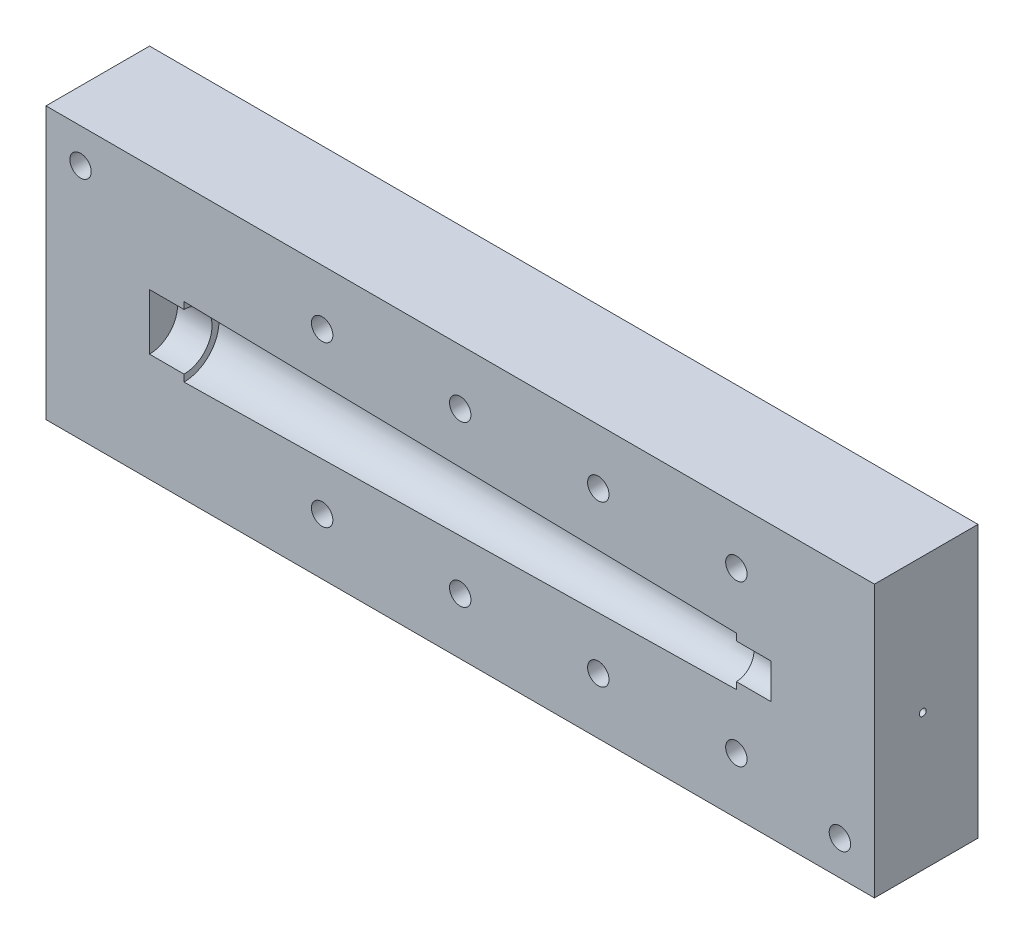
from build123d import *

# Parameters (mm, degrees)
SKIZZE2_W                        = 120
SKIZZE2_H                        = 39.364160046
AUFSATZ_LINEAR_AUSTRAGEN1_DEPTH  = 30
SKIZZE24_R                       = 1.55
SCHNITT_LINEAR_AUSTRAGEN4_DEPTH  = 130.805766806
SKIZZE46_R                       = 2.85
SCHNITT_LINEAR_AUSTRAGEN15_DEPTH = 10
SCHNITT_LINEAR_START             = -5
SCHNITT_LINEAR_AUSTRAGEN25_DEPTH = 2.7
LINEARES_MUSTER1_COUNT           = 4
LINEARES_MUSTER1_PITCH           = 20
SPIEGELN2_COPY_1_SKETCH_R        = 2.85
SPIEGELN2_COPY_1_DEPTH           = 10
SPIEGELN2_COPY_2_SKETCH_R        = 2.85
SPIEGELN2_COPY_2_DEPTH           = 10
SPIEGELN2_COPY_3_SKETCH_R        = 2.85
SPIEGELN2_COPY_3_DEPTH           = 10
SPIEGELN2_START                  = -5
SPIEGELN2_COPY_4_DEPTH           = 2.7
SPIEGELN2_COPY_5_DEPTH           = 2.7
SPIEGELN2_COPY_6_DEPTH           = 2.7
SKIZZE51_R                       = 1.55
SCHNITT_LINEAR_AUSTRAGEN26_DEPTH = 130.805766806
SKIZZE75_R                       = 0.75
SCHNITT_LINEAR_AUSTRAGEN28_DEPTH = 12
SKIZZE76_R                       = 2
SCHNITT_LINEAR_AUSTRAGEN29_DEPTH = 6
SKIZZE80_R                       = 0.5
SCHNITT_LINEAR_AUSTRAGEN34_DEPTH = 21.05
SCHNITT_LINEAR_START_2           = -7.5
SKIZZE81_R                       = 0.5
SCHNITT_LINEAR_AUSTRAGEN36_DEPTH = 5
FASE1_SIZE                       = 1
ABSPALTEN3_START                 = 15
ABSPALTEN3_OUTLINE_W             = 120
ABSPALTEN3_OUTLINE_H             = 39.364160046
ABSPALTEN3_OUTLINE_R             = 1.55
ABSPALTEN3_OUTLINE_R_2           = 0.75
ABSPALTEN3_DEPTH                 = 15


# Read off the part's stored shape, not the designer's step: Abspalten3
with BuildPart() as part:
    # Skizze2 → Aufsatz-Linear austragen1 (new body)
    with BuildSketch(Plane.XY):
        with Locations((60, 19.682080023)):
            Rectangle(SKIZZE2_W, SKIZZE2_H)
    extrude(amount=AUFSATZ_LINEAR_AUSTRAGEN1_DEPTH)

    # Skizze24 → Schnitt-Linear austragen4 (cut, through all)
    with BuildSketch(Plane.XY.offset(30)):
        with Locations((40, 31.364160046)):
            Circle(SKIZZE24_R)
        with Locations((60, 31.364160046)):
            Circle(SKIZZE24_R)
        with Locations((80, 31.364160046)):
            Circle(SKIZZE24_R)
        with Locations((100, 31.364160046)):
            Circle(SKIZZE24_R)
    schnitt_linear_austragen4 = extrude(amount=-SCHNITT_LINEAR_AUSTRAGEN4_DEPTH, mode=Mode.SUBTRACT)

    # Skizze46 → Schnitt-Linear austragen15 (cut)
    with BuildSketch(Plane(origin=(0, 0, 0), x_dir=(-1, 0, 0), z_dir=(0, 0, -1))):
        with Locations((-100, 31.364160046)):
            Circle(SKIZZE46_R)
    schnitt_linear_austragen15 = extrude(amount=-SCHNITT_LINEAR_AUSTRAGEN15_DEPTH, mode=Mode.SUBTRACT)

    # Skizze50 → Schnitt-Linear austragen25 (cut)
    with BuildSketch(Plane.XY.offset(30).offset(SCHNITT_LINEAR_START)):
        Polygon((97.15, 33.009608314), (97.15, 39.364160046), (102.85, 39.364160046), (102.85, 33.009608314), (102.85, 29.718711779), (100, 28.073263512), (97.15, 29.718711779), align=None)
    schnitt_linear_austragen25 = extrude(amount=-SCHNITT_LINEAR_AUSTRAGEN25_DEPTH, mode=Mode.SUBTRACT)

    # Lineares Muster1: Schnitt-Linear austragen15, Schnitt-Linear austragen25 ×4
    with Locations(*[(-i * LINEARES_MUSTER1_PITCH, 0, 0) for i in range(1, LINEARES_MUSTER1_COUNT)]):
        add(schnitt_linear_austragen15, mode=Mode.SUBTRACT)
        add(schnitt_linear_austragen25, mode=Mode.SUBTRACT)

    # Spiegeln2: Schnitt-Linear austragen15, Schnitt-Linear austragen25 across plane
    add(schnitt_linear_austragen15.mirror(Plane.ZX.offset(19.764160046)), mode=Mode.SUBTRACT)
    add(schnitt_linear_austragen25.mirror(Plane.ZX.offset(19.764160046)), mode=Mode.SUBTRACT)

    # Spiegeln2 copy 1 sketch → Spiegeln2 copy 1 (cut)
    with BuildSketch(Plane(origin=(-20, 39.528320093, 0), x_dir=(-1, 0, 0), z_dir=(0, 0, -1))):
        with Locations((-100, -31.364160046)):
            Circle(SPIEGELN2_COPY_1_SKETCH_R)
    extrude(amount=-SPIEGELN2_COPY_1_DEPTH, mode=Mode.SUBTRACT)

    # Spiegeln2 copy 2 sketch → Spiegeln2 copy 2 (cut)
    with BuildSketch(Plane(origin=(-40, 39.528320093, 0), x_dir=(-1, 0, 0), z_dir=(0, 0, -1))):
        with Locations((-100, -31.364160046)):
            Circle(SPIEGELN2_COPY_2_SKETCH_R)
    extrude(amount=-SPIEGELN2_COPY_2_DEPTH, mode=Mode.SUBTRACT)

    # Spiegeln2 copy 3 sketch → Spiegeln2 copy 3 (cut)
    with BuildSketch(Plane(origin=(-60, 39.528320093, 0), x_dir=(-1, 0, 0), z_dir=(0, 0, -1))):
        with Locations((-100, -31.364160046)):
            Circle(SPIEGELN2_COPY_3_SKETCH_R)
    extrude(amount=-SPIEGELN2_COPY_3_DEPTH, mode=Mode.SUBTRACT)

    # Spiegeln2 copy 4 sketch → Spiegeln2 copy 4 (cut)
    with BuildSketch(Plane(origin=(-20, 39.528320093, 30), x_dir=(1, 0, 0), z_dir=(0, 0, 1)).offset(SPIEGELN2_START)):
        Polygon((97.15, -33.009608314), (97.15, -39.364160046), (102.85, -39.364160046), (102.85, -33.009608314), (102.85, -29.718711779), (100, -28.073263512), (97.15, -29.718711779), align=None)
    extrude(amount=-SPIEGELN2_COPY_4_DEPTH, mode=Mode.SUBTRACT)

    # Spiegeln2 copy 5 sketch → Spiegeln2 copy 5 (cut)
    with BuildSketch(Plane(origin=(-40, 39.528320093, 30), x_dir=(1, 0, 0), z_dir=(0, 0, 1)).offset(SPIEGELN2_START)):
        Polygon((97.15, -33.009608314), (97.15, -39.364160046), (102.85, -39.364160046), (102.85, -33.009608314), (102.85, -29.718711779), (100, -28.073263512), (97.15, -29.718711779), align=None)
    extrude(amount=-SPIEGELN2_COPY_5_DEPTH, mode=Mode.SUBTRACT)

    # Spiegeln2 copy 6 sketch → Spiegeln2 copy 6 (cut)
    with BuildSketch(Plane(origin=(-60, 39.528320093, 30), x_dir=(1, 0, 0), z_dir=(0, 0, 1)).offset(SPIEGELN2_START)):
        Polygon((97.15, -33.009608314), (97.15, -39.364160046), (102.85, -39.364160046), (102.85, -33.009608314), (102.85, -29.718711779), (100, -28.073263512), (97.15, -29.718711779), align=None)
    extrude(amount=-SPIEGELN2_COPY_6_DEPTH, mode=Mode.SUBTRACT)

    # Spiegeln3: Schnitt-Linear austragen4 across plane
    add(schnitt_linear_austragen4.mirror(Plane.ZX.offset(19.764160046)), mode=Mode.SUBTRACT)

    # Skizze51 → Schnitt-Linear austragen26 (cut, through all)
    with BuildSketch(Plane.XY.offset(30)):
        with Locations((5, 34.364160046)):
            Circle(SKIZZE51_R)
        with Locations((115, 5)):
            Circle(SKIZZE51_R)
    extrude(amount=-SCHNITT_LINEAR_AUSTRAGEN26_DEPTH, mode=Mode.SUBTRACT)

    # Skizze73 → Schnitt-Rotation5 (revolve, cut)
    with BuildSketch(Plane.XY.offset(15)):
        Polygon((15, 19.764160046), (15, 23.814160046), (20, 23.814160046), (20, 24.814160046), (100, 23.232080023), (100, 22.232080023), (105, 22.232080023), (105, 19.682080023), align=None)
    revolve(axis=Axis((105, 19.682080023, 15), (-0.9999995841280241, 0.0009119998787298228, 0)), mode=Mode.SUBTRACT)

    # Skizze75 → Schnitt-Linear austragen28 (cut)
    with BuildSketch(Plane.XY.offset(30)):
        with Locations((21.598259807, 19.682080023)):
            Circle(SKIZZE75_R)
    extrude(amount=-SCHNITT_LINEAR_AUSTRAGEN28_DEPTH, mode=Mode.SUBTRACT)

    # Skizze76 → Schnitt-Linear austragen29 (cut)
    with BuildSketch(Plane.XY.offset(30)):
        with Locations((21.598259807, 19.682080023)):
            Circle(SKIZZE76_R)
    extrude(amount=-SCHNITT_LINEAR_AUSTRAGEN29_DEPTH, mode=Mode.SUBTRACT)

    # Skizze80 → Schnitt-Linear austragen34 (cut)
    with BuildSketch(Plane(origin=(120, 0, 0), x_dir=(0, 0, -1), z_dir=(1, 0, 0))):
        with Locations((-22.000416524, 19.763714623)):
            Circle(SKIZZE80_R)
    schnitt_linear_austragen34 = extrude(amount=-SCHNITT_LINEAR_AUSTRAGEN34_DEPTH, mode=Mode.SUBTRACT)

    # Skizze81 → Schnitt-Linear austragen36 (cut)
    with BuildSketch(Plane.XY.offset(30).offset(SCHNITT_LINEAR_START_2)):
        with Locations(Location((99, 19.682080023, 0), (0, 0, 7.034090001))):
            Circle(SKIZZE81_R)
    schnitt_linear_austragen36 = extrude(amount=-SCHNITT_LINEAR_AUSTRAGEN36_DEPTH, mode=Mode.SUBTRACT)

    # Spiegeln4: Schnitt-Linear austragen34, Schnitt-Linear austragen36 across plane
    add(schnitt_linear_austragen34.mirror(Plane.XY.offset(15)), mode=Mode.SUBTRACT)
    add(schnitt_linear_austragen36.mirror(Plane.XY.offset(15)), mode=Mode.SUBTRACT)

    # Fase1
    fase1_edges = [part.edges().sort_by_distance(p)[0] for p in [
        (20.848259807, 19.682080023, 24),
    ]]
    chamfer(fase1_edges, length=FASE1_SIZE)

    # Abspalten3 outline → Abspalten3 (cut)
    with BuildSketch(Plane.XY.offset(ABSPALTEN3_START)):
        with Locations((60, 19.682080023)):
            Rectangle(ABSPALTEN3_OUTLINE_W, ABSPALTEN3_OUTLINE_H)
        with Locations((115, 5)):
            Circle(ABSPALTEN3_OUTLINE_R, mode=Mode.SUBTRACT)
        with Locations((5, 34.364160046)):
            Circle(ABSPALTEN3_OUTLINE_R, mode=Mode.SUBTRACT)
        with Locations((40, 31.364160046)):
            Circle(ABSPALTEN3_OUTLINE_R, mode=Mode.SUBTRACT)
        with Locations((60, 31.364160046)):
            Circle(ABSPALTEN3_OUTLINE_R, mode=Mode.SUBTRACT)
        with Locations((80, 31.364160046)):
            Circle(ABSPALTEN3_OUTLINE_R, mode=Mode.SUBTRACT)
        with Locations((100, 31.364160046)):
            Circle(ABSPALTEN3_OUTLINE_R, mode=Mode.SUBTRACT)
        with Locations((40, 8.164160046)):
            Circle(ABSPALTEN3_OUTLINE_R, mode=Mode.SUBTRACT)
        with Locations((60, 8.164160046)):
            Circle(ABSPALTEN3_OUTLINE_R, mode=Mode.SUBTRACT)
        with Locations((80, 8.164160046)):
            Circle(ABSPALTEN3_OUTLINE_R, mode=Mode.SUBTRACT)
        with Locations((100, 8.164160046)):
            Circle(ABSPALTEN3_OUTLINE_R, mode=Mode.SUBTRACT)
        with Locations((21.598259807, 19.682080023)):
            Circle(ABSPALTEN3_OUTLINE_R_2, mode=Mode.SUBTRACT)
    extrude(amount=ABSPALTEN3_DEPTH, mode=Mode.SUBTRACT)


solid = part.part
